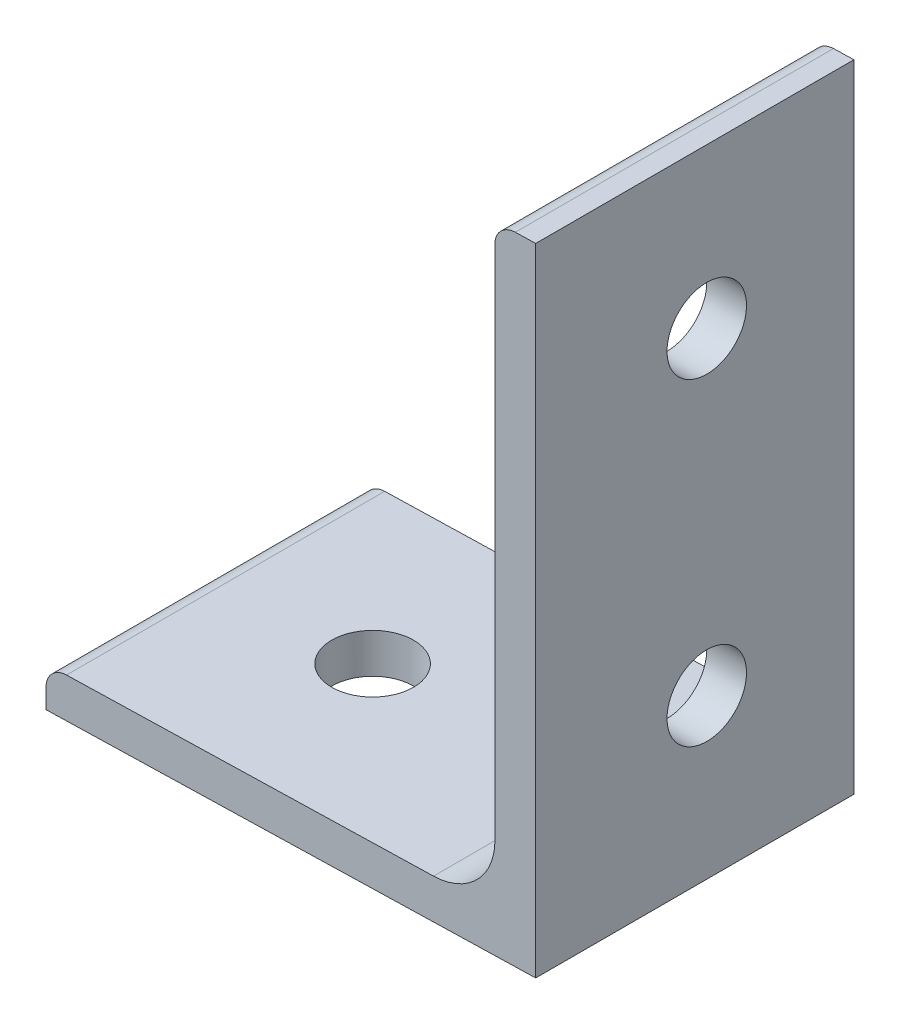
from build123d import *

# Parameters (mm, degrees)
BOSS_EXTRUDE1_DEPTH     = 15.875
SKETCH4_R               = 3.175
CUT_EXTRUDE1_DEPTH      = 49.464271634
SKETCH3_OUTSIDE_W       = 54.3
SKETCH3_OUTSIDE_H       = 47.95
CUT_EXTRUDE2_DEPTH      = 57.529267862
F_1_4_CLEARANCE_HOLE1_D = 6.5278
SKETCH9_R               = 6.35
CUT_EXTRUDE3_DEPTH      = 2.54


with BuildPart() as part:
    # Sketch2 → Boss-Extrude1 (new, symmetric)
    with BuildSketch(Plane.XY):
        with BuildLine():
            Line((-19.05, -25.4), (19.05, -25.4))
            Line((19.05, -25.4), (19.05, 25.4))
            Line((19.05, 25.4), (17.4625, 25.4))
            ThreePointArc((17.4625, 25.4), (16.339967985, 24.935032015), (15.875, 23.8125))
            Line((15.875, 23.8125), (15.875, -17.4498))
            ThreePointArc((15.875, -17.4498), (14.476376302, -20.826376302), (11.0998, -22.225))
            Line((11.0998, -22.225), (-17.4625, -22.225))
            ThreePointArc((-17.4625, -22.225), (-18.585032015, -22.689967985), (-19.05, -23.8125))
            Line((-19.05, -23.8125), (-19.05, -25.4))
        make_face()
    extrude(amount=BOSS_EXTRUDE1_DEPTH, both=True)

    # Sketch4 → Cut-Extrude1 (cut, through all)
    with BuildSketch(Plane(origin=(19.05, 0, 0), x_dir=(0, 0, -1), z_dir=(1, 0, 0))):
        with Locations((3.175, 12.7)):
            Circle(SKETCH4_R)
        with Locations((3.175, -12.7)):
            Circle(SKETCH4_R)
    extrude(amount=-CUT_EXTRUDE1_DEPTH, mode=Mode.SUBTRACT)

    # Sketch3 outside → Cut-Extrude2 (cut, through all)
    with BuildSketch(Plane.XZ.offset(25.4)):
        Rectangle(SKETCH3_OUTSIDE_W, SKETCH3_OUTSIDE_H)
        Polygon((-19.05, -13.926834826), (19.05, -14.924518438), (19.05, 10.484188491), (-19.05, 11.481872103), align=None, mode=Mode.SUBTRACT)
    extrude(amount=-CUT_EXTRUDE2_DEPTH, mode=Mode.SUBTRACT)

    # 1/4 Clearance Hole1 (through all)
    with Locations(Plane(origin=(0, -25.4, 0), x_dir=(-1, 0, 0), z_dir=(0, -1, 0))):
        with Locations((6.021904729, 1.563634042)):
            Hole(F_1_4_CLEARANCE_HOLE1_D / 2)

    # Sketch9 → Cut-Extrude3 (cut)
    with BuildSketch(Plane.ZY.offset(-15.875)):
        with Locations((-3.175, -12.7)):
            Circle(SKETCH9_R)
    extrude(amount=CUT_EXTRUDE3_DEPTH, mode=Mode.SUBTRACT)


solid = part.part
